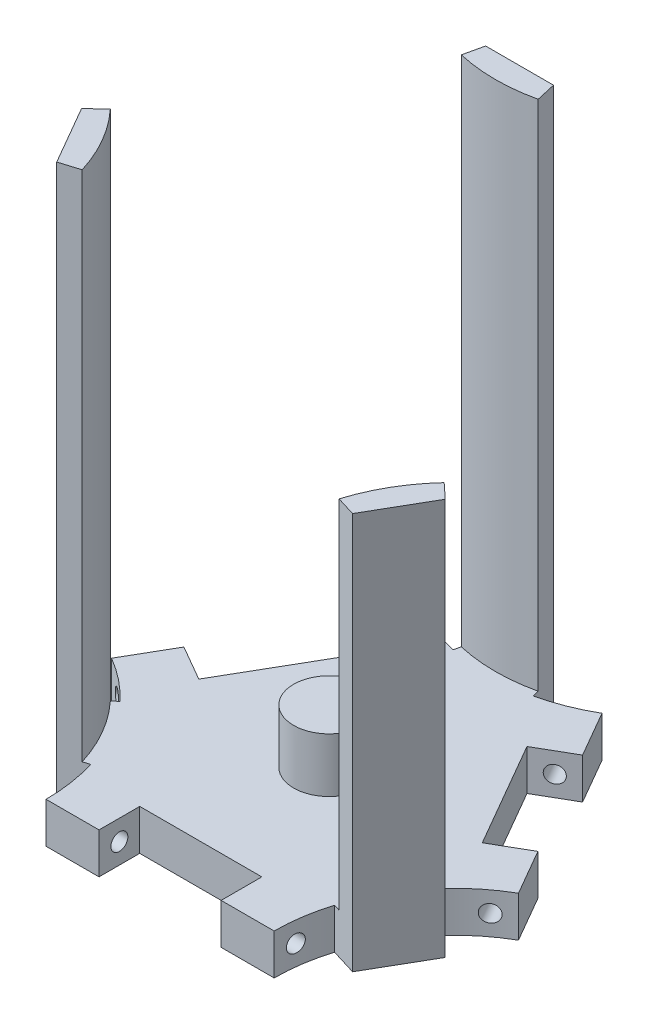
from build123d import *
from build123d.topology import SkipClean

# Parameters (mm, degrees)
BOSS_EXTRUDE1_DEPTH     = 3
SKETCH2_R               = 2.625
BOSS_EXTRUDE2_DEPTH     = 4
SKETCH3_W               = 9
SKETCH3_H               = 3
CUT_EXTRUDE1_DEPTH      = 46.717381
CUT_EXTRUDE2_DEPTH      = 47.39176
CUT_EXTRUDE2_DEPTH_BACK = 47.39176
SKETCH4_R               = 0.625
CUT_EXTRUDE3_DEPTH      = 33.475582
CUT_EXTRUDE3_DEPTH_BACK = 33.475582
SKETCH5_R               = 0.625
CUT_EXTRUDE4_DEPTH      = 34.635959
CUT_EXTRUDE4_DEPTH_BACK = 34.635959
SKETCH6_R               = 0.625
BOSS_EXTRUDE3_DEPTH     = 26.25
SCALE1_SCALE            = 1.3
BOSS_EXTRUDE5_DEPTH     = 15


with BuildPart() as part:
    # Sketch1 → Boss-Extrude1 (new body)
    with BuildSketch(Plane(origin=(0, 0, 0), x_dir=(1, 0, 0), z_dir=(0, 1, 0))):
        with BuildLine():
            Line((6.591682, 11.417128), (15, 25.980762))
            ThreePointArc((15, 25.980762), (16.768877, 25.128389), (18.644756, 24.548268))
            Line((18.644756, 24.548268), (19.091682, 26.497693))
            Line((19.091682, 26.497693), (24.091682, 26.497693))
            Line((24.091682, 26.497693), (24.538608, 24.548268))
            ThreePointArc((24.538608, 24.548268), (26.414488, 25.128389), (28.183364, 25.980762))
            Line((28.183364, 25.980762), (36.591682, 11.417128))
            ThreePointArc((36.591682, 11.417128), (34.969067, 10.311423), (33.528728, 8.976924))
            Line((33.528728, 8.976924), (34.993516, 7.615162))
            Line((34.993516, 7.615162), (32.493516, 3.285035))
            Line((32.493516, 3.285035), (30.581801, 3.872698))
            ThreePointArc((30.581801, 3.872698), (30.146262, 1.958078), (30, 0))
            Line((30, 0), (13.183364, 0))
            ThreePointArc((13.183364, 0), (13.037102, 1.958078), (12.601563, 3.872698))
            Line((12.601563, 3.872698), (10.689848, 3.285035))
            Line((10.689848, 3.285035), (8.189848, 7.615162))
            Line((8.189848, 7.615162), (9.654636, 8.976924))
            ThreePointArc((9.654636, 8.976924), (8.214297, 10.311423), (6.591682, 11.417128))
        make_face()
    extrude(amount=BOSS_EXTRUDE1_DEPTH)

    # Sketch2 → Boss-Extrude2 (add)
    with BuildSketch(Plane(origin=(0, 3, 0), x_dir=(1, 0, 0), z_dir=(0, 1, 0))):
        with Locations((21.591682, 12.465963)):
            Circle(SKETCH2_R)
    extrude(amount=BOSS_EXTRUDE2_DEPTH)

    # Sketch3 → Cut-Extrude1 (cut, through all)
    with BuildSketch(Plane.XZ):
        with Locations((21.591682, -1.5)):
            Rectangle(SKETCH3_W, SKETCH3_H)
        Polygon((8.545841, -14.801831), (13.045841, -22.59606), (15.643917, -21.09606), (11.143917, -13.301831), align=None)
        Polygon((34.637523, -14.801831), (32.039447, -13.301831), (27.539447, -21.09606), (30.137523, -22.59606), align=None)
    extrude(amount=-CUT_EXTRUDE1_DEPTH, mode=Mode.SUBTRACT)

    # Sketch4 → Cut-Extrude2 (cut, two sides: drawn at the far end of the back side and taken through both)
    with BuildSketch(Plane(origin=(2.25, 0, 3.897114), x_dir=(-0.8660254037844389, 0, 0.4999999999999997), z_dir=(-0.4999999999999997, 0, -0.8660254037844389)).offset(-CUT_EXTRUDE2_DEPTH_BACK)):
        with Locations((-35.89789, 1.5)):
            Circle(SKETCH4_R)
    extrude(amount=CUT_EXTRUDE2_DEPTH + CUT_EXTRUDE2_DEPTH_BACK, mode=Mode.SUBTRACT)

    # Sketch5 → Cut-Extrude3 (cut, two sides: drawn at the far end of the back side and taken through both)
    with BuildSketch(Plane(origin=(8.545841, 0, -14.801831), x_dir=(-0.8660254037844383, 0, -0.5000000000000008), z_dir=(0.5000000000000007, 0, -0.8660254037844382)).offset(-CUT_EXTRUDE3_DEPTH_BACK)):
        with Locations((-1.5, 1.5)):
            Circle(SKETCH5_R)
    extrude(amount=CUT_EXTRUDE3_DEPTH + CUT_EXTRUDE3_DEPTH_BACK, mode=Mode.SUBTRACT)

    # Sketch6 → Cut-Extrude4 (cut, two sides: drawn at the far end of the back side and taken through both)
    with BuildSketch(Plane.ZY.offset(-26.091682).offset(-CUT_EXTRUDE4_DEPTH_BACK)):
        with Locations((-1.5, 1.5)):
            Circle(SKETCH6_R)
    extrude(amount=CUT_EXTRUDE4_DEPTH + CUT_EXTRUDE4_DEPTH_BACK, mode=Mode.SUBTRACT)

    # Sketch7 → Boss-Extrude3 (add)
    with BuildSketch(Plane(origin=(0, 3, 0), x_dir=(1, 0, 0), z_dir=(0, 1, 0))):
        with BuildLine():
            Line((8.189848, 7.615162), (10.689848, 3.285035))
            Line((10.689848, 3.285035), (12.123634, 3.725783))
            ThreePointArc((12.123634, 3.725783), (10.98389, 6.341552), (9.288439, 8.636484))
            Line((9.288439, 8.636484), (8.189848, 7.615162))
        make_face()
        with BuildLine():
            Line((32.493516, 3.285035), (34.993516, 7.615162))
            Line((34.993516, 7.615162), (33.894925, 8.636484))
            ThreePointArc((33.894925, 8.636484), (32.199474, 6.341552), (31.05973, 3.725783))
            Line((31.05973, 3.725783), (32.493516, 3.285035))
        make_face()
        with BuildLine():
            Line((19.091682, 26.497693), (24.091682, 26.497693))
            Line((24.091682, 26.497693), (24.426877, 25.035624))
            ThreePointArc((24.426877, 25.035624), (21.591682, 24.714787), (18.756487, 25.035624))
            Line((18.756487, 25.035624), (19.091682, 26.497693))
        make_face()
    extrude(amount=BOSS_EXTRUDE3_DEPTH)


with BuildPart() as part_1:
    # Scale1: scaled about (21.591676, 6.281762, -12.465985)
    add(part.part.scale(SCALE1_SCALE).moved(Location((-6.477503, -1.884529, 3.739795))))


with BuildPart() as boss_extrude5_tool:
    # Sketch10 → Boss-Extrude5 (new body)
    with SkipClean():  # the faces are left unmerged after this step: merging them gives an invalid solid
        with BuildSketch(Plane(origin=(0, 36.140472, 0), x_dir=(1, 0, 0), z_dir=(0, 1, 0))):
            with BuildLine():
                Line((17.905928, 28.806521), (18.341681, 30.707211))
                Line((18.341681, 30.707211), (24.841681, 30.707211))
                Line((24.841681, 30.707211), (25.277434, 28.806521))
                ThreePointArc((25.277434, 28.806521), (21.591681, 28.389433), (17.905928, 28.806521))
            make_face()
            with BuildLine():
                Line((5.597466, 7.487639), (4.169297, 6.159921))
                Line((4.169297, 6.159921), (7.419297, 0.530756))
                Line((7.419297, 0.530756), (9.283219, 1.103728))
                ThreePointArc((9.283219, 1.103728), (7.801551, 4.504228), (5.597466, 7.487639))
            make_face()
        extrude(amount=BOSS_EXTRUDE5_DEPTH)


with BuildPart() as part_2:
    with SkipClean():  # the faces are left unmerged after this step: merging them gives an invalid solid
        add(part_1.part)


with BuildPart() as part_3:
    # Boss-Extrude5: joined with boss_extrude5_tool
    with SkipClean():  # the faces are left unmerged after this step: merging them gives an invalid solid
        add(part_2.part.fuse(boss_extrude5_tool.part, tol=0.00001))


solid = part_3.part
